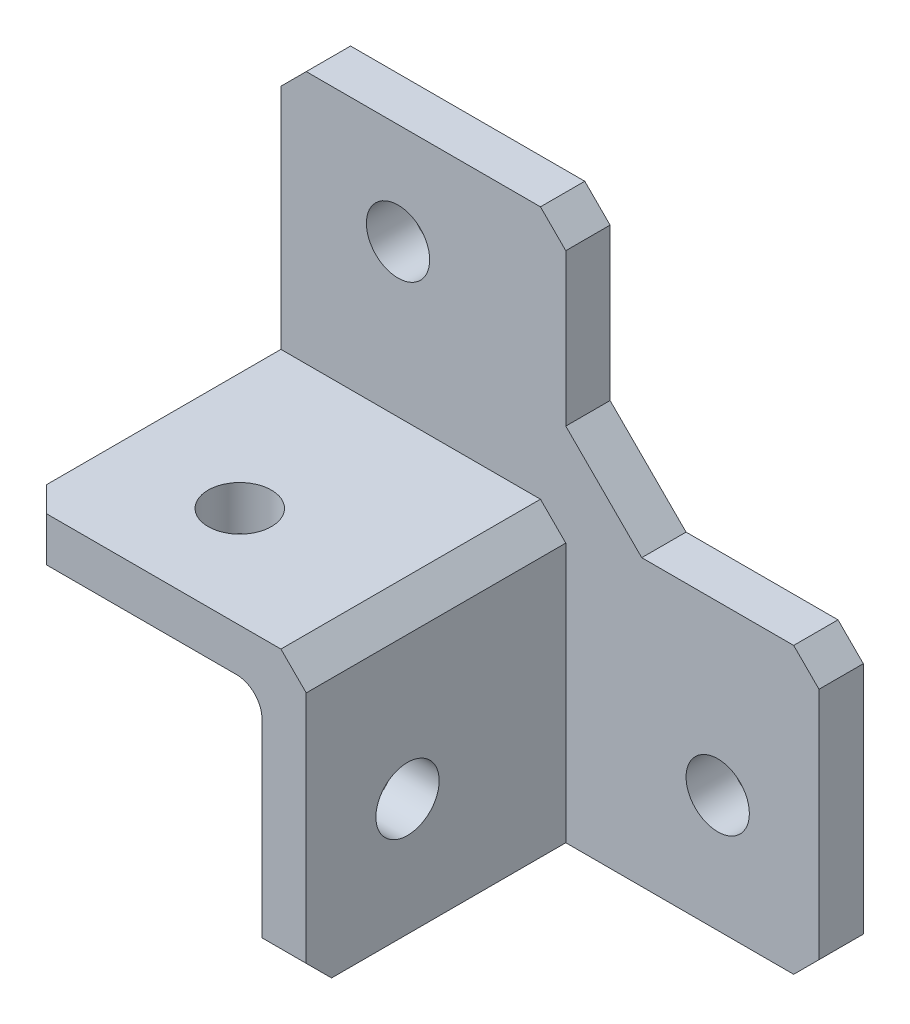
from build123d import *

# Parameters (mm, degrees)
ESQUISSE1_W             = 3.5
ESQUISSE1_H             = 3.5
BOSS_EXTRU_1_DEPTH      = 3.5
ESQUISSE2_W             = 19
ESQUISSE2_H             = 3.5
ESQUISSE2_W_2           = 3.5
ESQUISSE2_H_2           = 19
BOSS_EXTRU_2_DEPTH      = 20.5
ESQUISSE3_R             = 2.5
ENL_V_MAT_EXTRU_2_DEPTH = 3.5
ESQUISSE4_R             = 2.5
ENL_V_MAT_EXTRU_3_DEPTH = 3.5
ESQUISSE5_R             = 2.5
ENL_V_MAT_EXTRU_4_DEPTH = 3.5
ESQUISSE6_R             = 2.5
ENL_V_MAT_EXTRU_5_DEPTH = 3.5
CHANFREIN1_SIZE         = 6
CHANFREIN2_SIZE         = 2
CHANFREIN3_SIZE         = 2
CONG_1_R                = 2


with BuildPart() as part:
    # Esquisse1 → Boss.-Extru.1 (new body)
    with BuildSketch(Plane.XY):
        Polygon((-23.276688067, 13.678057554), (-45.776688067, 13.678057554), (-45.776688067, -9.821942446), (-26.776688067, -9.821942446), (-26.776688067, -6.321942446), (-23.276688067, -6.321942446), align=None)
        with Locations((-25.026688067, -8.071942446)):
            Rectangle(ESQUISSE1_W, ESQUISSE1_H)
        Polygon((-3.276688067, -6.321942446), (-23.276688067, -6.321942446), (-23.276688067, -9.821942446), (-26.776688067, -9.821942446), (-26.776688067, -28.821942446), (-3.276688067, -28.821942446), align=None)
    extrude(amount=BOSS_EXTRU_1_DEPTH)

    # Esquisse2 → Boss.-Extru.2 (add)
    with BuildSketch(Plane.XY.offset(3.5)):
        with Locations((-36.276688067, -8.071942446)):
            Rectangle(ESQUISSE2_W, ESQUISSE2_H)
        with Locations((-25.026688067, -8.071942446)):
            Rectangle(ESQUISSE2_W_2, ESQUISSE2_H)
        with Locations((-25.026688067, -19.321942446)):
            Rectangle(ESQUISSE2_W_2, ESQUISSE2_H_2)
    extrude(amount=BOSS_EXTRU_2_DEPTH)

    # Esquisse3 → Enlèv. mat.-Extru.2 (cut)
    with BuildSketch(Plane(origin=(0, -6.321942446, 0), x_dir=(1, 0, 0), z_dir=(0, 1, 0))):
        with Locations(Location((-36.526688067, -16, 0), (0, 0, 270))):
            Circle(ESQUISSE3_R)
    extrude(amount=-ENL_V_MAT_EXTRU_2_DEPTH, mode=Mode.SUBTRACT)

    # Esquisse4 → Enlèv. mat.-Extru.3 (cut)
    with BuildSketch(Plane(origin=(-23.276688067, 0, 0), x_dir=(0, 0, -1), z_dir=(1, 0, 0))):
        with Locations((-16, -19.571942446)):
            Circle(ESQUISSE4_R)
    extrude(amount=-ENL_V_MAT_EXTRU_3_DEPTH, mode=Mode.SUBTRACT)

    # Esquisse5 → Enlèv. mat.-Extru.4 (cut)
    with BuildSketch(Plane.XY.offset(3.5)):
        with Locations((-36.526688067, 5.678057554)):
            Circle(ESQUISSE5_R)
    extrude(amount=-ENL_V_MAT_EXTRU_4_DEPTH, mode=Mode.SUBTRACT)

    # Esquisse6 → Enlèv. mat.-Extru.5 (cut)
    with BuildSketch(Plane.XY.offset(3.5)):
        with Locations((-11.276688067, -19.571942446)):
            Circle(ESQUISSE6_R)
    extrude(amount=-ENL_V_MAT_EXTRU_5_DEPTH, mode=Mode.SUBTRACT)

    # Chanfrein1
    # the kernel refuses this chamfer: 6 mm, written as the material it adds along each edge
    with BuildSketch(Plane(origin=(-23.276688067, -6.321942446, 0), x_dir=(-0.027495876610586202, 0.9996219169112968, 0), z_dir=(0, 0, 1))) as chanfrein1_piece_1:
        Polygon((CHANFREIN1_SIZE * 0.999621916911, -CHANFREIN1_SIZE * 0.0274958766106), (-CHANFREIN1_SIZE * 0.0274958766106, -CHANFREIN1_SIZE * 0.999621916911), (0, 0), align=None)
    extrude(amount=3.5)

    # Chanfrein2
    chanfrein2_edges = [part.edges().sort_by_distance(p)[0] for p in [
        (-23.276688067, -6.321942446, 13.75),
    ]]
    chamfer(chanfrein2_edges, length=CHANFREIN2_SIZE)

    # Chanfrein3
    chanfrein3_edges = [part.edges().sort_by_distance(p)[0] for p in [
        (-45.776688067, 13.678057554, 1.75),
        (-23.276688067, 13.678057554, 1.75),
        (-3.276688067, -6.321942446, 1.75),
        (-3.276688067, -28.821942446, 1.75),
        (-25.026688067, -28.821942446, 24),
        (-45.776688067, -8.071942446, 24),
    ]]
    chamfer(chanfrein3_edges, length=CHANFREIN3_SIZE)

    # Congé1
    cong_1_edges = [part.edges().sort_by_distance(p)[0] for p in [
        (-26.776688067, -9.821942446, 12),
    ]]
    fillet(cong_1_edges, radius=CONG_1_R)


solid = part.part
